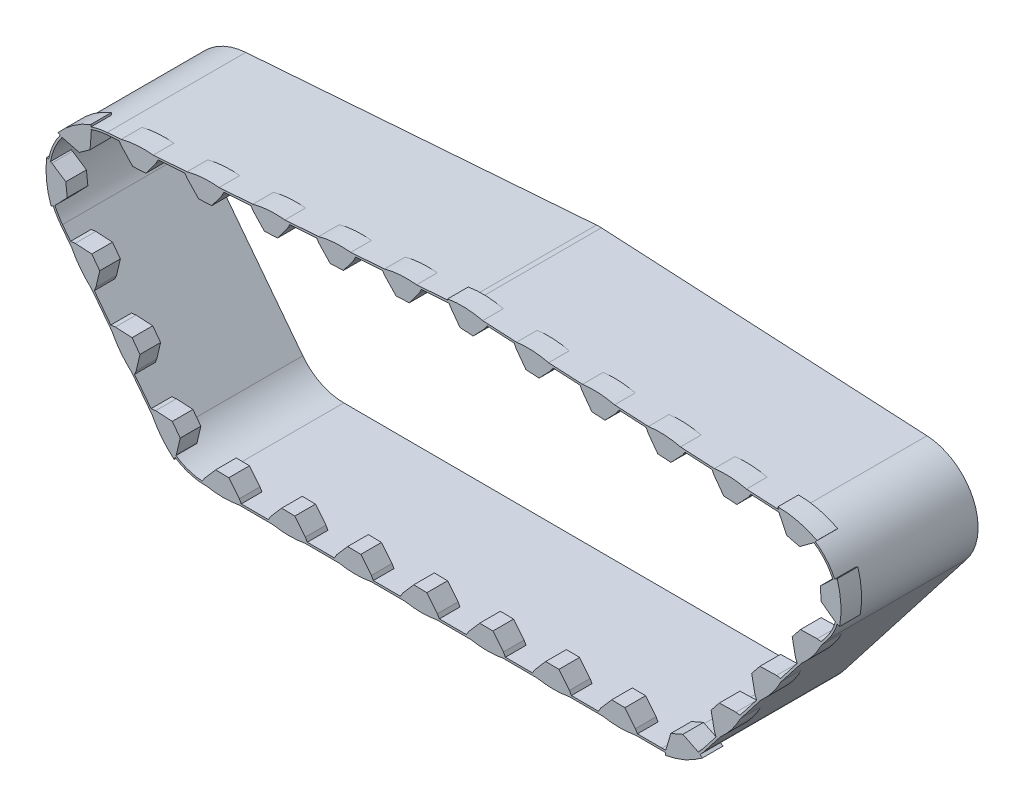
from build123d import *

# Parameters (mm, degrees)
EXTRUDE_THIN1_DEPTH = 23.5
BOSS_EXTRUDE2_DEPTH = 7
CRVPATTERN4_START   = 16.5
CRVPATTERN4_DEPTH   = 7


# Read off the part's stored shape, not the designer's step: CrvPattern4
with BuildPart() as part:
    # Sketch2 → Extrude-Thin1 (new, symmetric)
    with BuildSketch(Plane.XY):
        with BuildLine():
            Line((17.163468236, -58.085931667), (-17.281893756, -13.288195823))
            ThreePointArc((-17.281893756, -13.288195823), (-19.897637951, 8.906402414), (-1.60242719, 21.741026358))
            Line((-1.60242719, 21.741026358), (117.263507159, 30.502066523))
            ThreePointArc((117.263507159, 30.502066523), (118.105083127, 30.537349971), (118.94720479, 30.519290718))
            Line((118.94720479, 30.519290718), (229.299625502, 24.652631518))
            ThreePointArc((229.299625502, 24.652631518), (244.976573908, 13.975728829), (242.768549107, -4.862731534))
            Line((242.768549107, -4.862731534), (200.935093877, -58.602091631))
            ThreePointArc((200.935093877, -58.602091631), (194.508519277, -63.812915391), (186.443863356, -65.660852138))
            Line((186.443863356, -65.660852138), (31.619949002, -65.231091278))
            ThreePointArc((31.619949002, -65.231091278), (23.562249738, -63.336718399), (17.163468236, -58.085931667))
        make_face()
        with BuildLine():
            Line((17.71839143, -57.65924648), (-16.726970562, -12.861510636))
            ThreePointArc((-16.726970562, -12.861510636), (-19.258722971, 8.620417015), (-1.550973106, 21.042920007))
            Line((-1.550973106, 21.042920007), (117.314961243, 29.803960172))
            ThreePointArc((117.314961243, 29.803960172), (118.112243739, 29.837386596), (118.910043209, 29.820277831))
            Line((118.910043209, 29.820277831), (229.262463921, 23.95361863))
            ThreePointArc((229.262463921, 23.95361863), (244.339747634, 13.685122055), (242.216182798, -4.432741463))
            Line((242.216182798, -4.432741463), (200.382727568, -58.17210156))
            ThreePointArc((200.382727568, -58.17210156), (194.201978227, -63.183604192), (186.445806412, -64.960854834))
            Line((186.445806412, -64.960854834), (31.621892057, -64.531093975))
            ThreePointArc((31.621892057, -64.531093975), (23.872410798, -62.709183447), (17.71839143, -57.65924648))
        make_face(mode=Mode.SUBTRACT)
    extrude(amount=EXTRUDE_THIN1_DEPTH, both=True)

    # Sketch4 → Boss-Extrude2 (add)
    with BuildSketch(Plane.XY.offset(23.5)):
        with BuildLine():
            Line((-22.091749971, 4.168077882), (-20.324857335, 3.393288321))
            Line((-20.324857335, 3.393288321), (-15.620947302, 0.258821223))
            Line((-15.620947302, 0.258821223), (-15.128773127, -4.183345681))
            Line((-15.128773127, -4.183345681), (-19.032446032, -8.27149825))
            Line((-19.032446032, -8.27149825), (-20.586879792, -9.414277379))
            ThreePointArc((-20.586879792, -9.414277379), (-22.145163092, -2.71238448), (-22.091749971, 4.168077882))
        make_face()
    extrude(amount=-BOSS_EXTRUDE2_DEPTH)

    # CrvPattern4 outline → CrvPattern4 (add)
    with BuildSketch(Plane.XY.offset(CRVPATTERN4_START)):
        Polygon((-13.995992217, -16.413270275), (-5.946516809, -26.881973525), (-5.407950455, -25.625727536), (-4.116665995, -20.122615868), (-6.793577986, -16.543618186), (-12.437314215, -16.22755655), align=None)
        Polygon((1.203948182, -33.968629198), (-0.35472982, -34.154342922), (7.694745589, -44.623046172), (8.233311942, -43.366800183), (9.524596403, -37.863688516), (6.847684411, -34.284690833), align=None)
        with BuildLine():
            Line((14.84521058, -51.709701846), (13.286532578, -51.89541557))
            Line((13.286532578, -51.89541557), (17.71839143, -57.65924648))
            ThreePointArc((17.71839143, -57.65924648), (19.572941622, -59.714085103), (21.726723374, -61.452746183))
            Line((21.726723374, -61.452746183), (21.87457434, -61.107872831))
            Line((21.87457434, -61.107872831), (23.1658588, -55.604761163))
            Line((23.1658588, -55.604761163), (20.488946809, -52.025763481))
            Line((20.488946809, -52.025763481), (14.84521058, -51.709701846))
        make_face()
        with BuildLine():
            ThreePointArc((-7.01320231, 19.900376714), (-12.454147841, 17.032445554), (-16.836880551, 12.717289542))
            Line((-16.836880551, 12.717289542), (-16.512243373, 12.569705806))
            Line((-16.512243373, 12.569705806), (-11.038407177, 11.159467927))
            Line((-11.038407177, 11.159467927), (-7.40223924, 13.758191643))
            Line((-7.40223924, 13.758191643), (-6.963947723, 19.393753206))
            Line((-6.963947723, 19.393753206), (-7.01320231, 19.900376714))
        make_face()
        with BuildLine():
            Line((31.47654538, -63.181845509), (30.684865179, -64.503527555))
            ThreePointArc((30.684865179, -64.503527555), (31.153195051, -64.523550503), (31.621892057, -64.531093975))
            Line((31.621892057, -64.531093975), (43.875482358, -64.565107541))
            Line((43.875482358, -64.565107541), (43.211193095, -63.370566844))
            Line((43.211193095, -63.370566844), (39.647884743, -58.98257332))
            Line((39.647884743, -58.98257332), (35.179113421, -58.910704738))
            Line((35.179113421, -58.910704738), (31.47654538, -63.181845509))
        make_face()
        Polygon((15.637424805, 22.309794703), (2.46755138, 21.339106249), (3.221017708, 20.198713249), (7.108634912, 16.095289549), (11.569869984, 16.364480656), (14.935875815, 20.905588267), align=None)
        Polygon((37.956108944, 23.954798289), (24.786235519, 22.984109835), (25.539701847, 21.843716834), (29.427319051, 17.740293135), (33.888554123, 18.009484242), (37.254559954, 22.550591853), align=None)
        Polygon((53.855683871, -63.243965614), (53.049074347, -64.590571636), (66.254620849, -64.627227646), (65.590331586, -63.432686949), (62.027023233, -59.044693425), (57.558251911, -58.972824843), align=None)
        Polygon((60.274793082, 25.599801874), (47.104919658, 24.62911342), (47.858385986, 23.48872042), (51.74600319, 19.38529672), (56.207238262, 19.654487827), (59.573244092, 24.195595438), align=None)
        Polygon((76.234822361, -63.306085719), (75.428212837, -64.65269174), (88.633759339, -64.689347751), (87.969470076, -63.494807053), (84.406161724, -59.10681353), (79.937390402, -59.034944948), align=None)
        Polygon((82.593477221, 27.244805459), (69.423603797, 26.274117005), (70.177070125, 25.133724005), (74.064687329, 21.030300305), (78.525922401, 21.299491412), (81.891928231, 25.840599023), align=None)
        Polygon((98.613960852, -63.368205824), (97.807351328, -64.714811845), (111.01289783, -64.751467856), (110.348608567, -63.556927158), (106.785300214, -59.168933634), (102.316528892, -59.097065053), align=None)
        Polygon((104.91216136, 28.889809044), (91.742287936, 27.91912059), (92.495754264, 26.77872759), (96.383371468, 22.675303891), (100.84460654, 22.944494998), (104.21061237, 27.485602608), align=None)
        Polygon((120.993099342, -63.430325929), (120.186489818, -64.77693195), (133.39203632, -64.813587961), (132.727747057, -63.619047263), (129.164438705, -59.231053739), (124.695667383, -59.159185158), align=None)
        with BuildLine():
            Line((117.314961243, 29.803960172), (114.302019504, 29.58189063))
            Line((114.302019504, 29.58189063), (114.661190298, 28.851782918))
            Line((114.661190298, 28.851782918), (117.999199405, 24.290056404))
            Line((117.999199405, 24.290056404), (122.458694241, 23.993428653))
            Line((122.458694241, 23.993428653), (126.371478681, 28.072861397))
            Line((126.371478681, 28.072861397), (127.244822194, 29.377176469))
            Line((127.244822194, 29.377176469), (118.910043209, 29.820277831))
            ThreePointArc((118.910043209, 29.820277831), (118.112243739, 29.837386596), (117.314961243, 29.803960172))
        make_face()
        Polygon((143.372237833, -63.492446034), (142.565628309, -64.839052055), (155.771174811, -64.875708065), (155.106885548, -63.681167368), (151.543577195, -59.293173844), (147.074805873, -59.221305263), align=None)
        Polygon((165.751376323, -63.554566139), (164.944766799, -64.90117216), (178.150313301, -64.93782817), (177.486024038, -63.743287473), (173.922715686, -59.355293949), (169.453944364, -59.283425368), align=None)
        Polygon((149.592488599, 28.189108805), (136.405513236, 28.890167195), (137.008856702, 27.663715253), (140.346865809, 23.10198874), (144.806360645, 22.805360989), (148.719145085, 26.884793733), align=None)
        with BuildLine():
            Line((187.869484076, -64.586368055), (187.833615081, -64.90991692))
            ThreePointArc((187.833615081, -64.90991692), (193.730921212, -63.404504817), (198.76283621, -59.980425866))
            Line((198.76283621, -59.980425866), (198.617994631, -59.873927753))
            Line((198.617994631, -59.873927753), (193.551672853, -57.36712955))
            Line((193.551672853, -57.36712955), (189.458440838, -59.16171415))
            Line((189.458440838, -59.16171415), (187.869484076, -64.586368055))
        make_face()
        Polygon((171.940155003, 27.001041141), (158.75317964, 27.702099531), (159.356523106, 26.475647589), (162.694532213, 21.913921075), (167.154027049, 21.617293325), (171.066811489, 25.696726069), align=None)
        Polygon((194.287821407, 25.812973477), (181.100846044, 26.514031866), (181.70418951, 25.287579925), (185.042198617, 20.725853411), (189.501693454, 20.429225661), (193.414477893, 24.508658405), align=None)
        Polygon((204.236877518, -51.025214548), (204.808060631, -52.487307757), (212.919883132, -42.066840502), (211.568646823, -41.861005275), (205.917610186, -41.993060232), (203.125536559, -45.482960959), align=None)
        Polygon((216.635487811, 24.624905812), (203.448512448, 25.325964202), (204.051855915, 24.099512261), (207.389865021, 19.537785747), (211.849359858, 19.241157997), (215.762144297, 23.32059074), align=None)
        Polygon((217.98379811, -33.365886342), (218.554981224, -34.827979551), (226.666803724, -24.407512296), (225.315567415, -24.201677069), (219.664530778, -24.333732025), (216.872457151, -27.823632752), align=None)
        with BuildLine():
            Line((229.262463921, 23.95361863), (226.180679677, 24.117455343))
            Line((226.180679677, 24.117455343), (226.307088862, 23.683522876))
            Line((226.307088862, 23.683522876), (228.806400546, 18.613503676))
            Line((228.806400546, 18.613503676), (233.147508098, 17.550551445))
            Line((233.147508098, 17.550551445), (237.706501394, 20.892292563))
            Line((237.706501394, 20.892292563), (237.931645613, 21.127410691))
            ThreePointArc((237.931645613, 21.127410691), (233.783258382, 23.111680338), (229.262463921, 23.95361863))
        make_face()
        Polygon((231.730718702, -15.706558135), (232.301901816, -17.168651344), (240.413724316, -6.748184089), (239.062488007, -6.542348862), (233.411451371, -6.674403818), (230.619377743, -10.164304545), align=None)
        with BuildLine():
            ThreePointArc((245.252765769, 1.549750593), (245.885449328, 7.603195622), (244.418435091, 13.510170688))
            Line((244.418435091, 13.510170688), (244.268323741, 13.411238824))
            Line((244.268323741, 13.411238824), (240.160431112, 9.528344062))
            Line((240.160431112, 9.528344062), (240.424490607, 5.06680231))
            Line((240.424490607, 5.06680231), (244.961723542, 1.6955754))
            Line((244.961723542, 1.6955754), (245.252765769, 1.549750593))
        make_face()
        with BuildLine():
            Line((-6.946166616, -26.730271835), (-13.590426056, -18.089114882))
            ThreePointArc((-13.590426056, -18.089114882), (-10.675136676, -22.722516373), (-6.946166616, -26.730271835))
        make_face()
        with BuildLine():
            Line((6.695095781, -44.471344482), (0.050836341, -35.830187529))
            ThreePointArc((0.050836341, -35.830187529), (2.966125722, -40.46358902), (6.695095781, -44.471344482))
        make_face()
        with BuildLine():
            Line((-18.268572187, 13.368152766), (-17.489366985, 13.013917261))
            ThreePointArc((-17.489366985, 13.013917261), (-12.860866915, 17.602218672), (-7.082901217, 20.617286687))
            Line((-7.082901217, 20.617286687), (-7.150636779, 21.314002056))
            ThreePointArc((-7.150636779, 21.314002056), (-13.181035859, 18.000710309), (-18.268572187, 13.368152766))
        make_face()
        with BuildLine():
            Line((17.163468236, -58.085931667), (13.692098739, -53.571260177))
            ThreePointArc((13.692098739, -53.571260177), (16.923624315, -58.608548326), (21.114375882, -62.881092151))
            Line((21.114375882, -62.881092151), (21.445762422, -62.108108454))
            ThreePointArc((21.445762422, -62.108108454), (19.142152133, -60.269989882), (17.163468236, -58.085931667))
        make_face()
        with BuildLine():
            ThreePointArc((14.014498968, 22.892075379), (8.541386825, 23.0032735), (3.143721509, 22.090842305))
            Line((3.143721509, 22.090842305), (14.014498968, 22.892075379))
        make_face()
        with BuildLine():
            ThreePointArc((36.333183107, 24.537078964), (30.860070964, 24.648277085), (25.462405648, 23.73584589))
            Line((25.462405648, 23.73584589), (36.333183107, 24.537078964))
        make_face()
        with BuildLine():
            Line((43.143944183, -65.263079631), (32.24372118, -65.232822747))
            ThreePointArc((32.24372118, -65.232822747), (37.692408136, -65.761152194), (43.143944183, -65.263079631))
        make_face()
        with BuildLine():
            ThreePointArc((58.651867245, 26.182082549), (53.178755103, 26.293280671), (47.781089787, 25.380849476))
            Line((47.781089787, 25.380849476), (58.651867245, 26.182082549))
        make_face()
        with BuildLine():
            Line((65.523082674, -65.325199736), (54.622859671, -65.294942852))
            ThreePointArc((54.622859671, -65.294942852), (60.071546627, -65.823272298), (65.523082674, -65.325199736))
        make_face()
        with BuildLine():
            ThreePointArc((80.970551384, 27.827086135), (75.497439242, 27.938284256), (70.099773926, 27.025853061))
            Line((70.099773926, 27.025853061), (80.970551384, 27.827086135))
        make_face()
        with BuildLine():
            Line((87.902221164, -65.387319841), (77.001998161, -65.357062957))
            ThreePointArc((77.001998161, -65.357062957), (82.450685117, -65.885392403), (87.902221164, -65.387319841))
        make_face()
        with BuildLine():
            ThreePointArc((103.289235523, 29.47208972), (97.816123381, 29.583287841), (92.418458065, 28.670856646))
            Line((92.418458065, 28.670856646), (103.289235523, 29.47208972))
        make_face()
        with BuildLine():
            Line((110.281359655, -65.449439946), (99.381136652, -65.419183062))
            ThreePointArc((99.381136652, -65.419183062), (104.829823608, -65.947512508), (110.281359655, -65.449439946))
        make_face()
        with BuildLine():
            Line((113.809557497, 30.582947272), (113.968807701, 30.259229966))
            Line((113.968807701, 30.259229966), (117.263507159, 30.502066523))
            ThreePointArc((117.263507159, 30.502066523), (118.105083127, 30.537349971), (118.94720479, 30.519290718))
            Line((118.94720479, 30.519290718), (125.708471364, 30.159841904))
            ThreePointArc((125.708471364, 30.159841904), (119.780811476, 30.984388866), (113.809557497, 30.582947272))
        make_face()
        with BuildLine():
            Line((132.660498145, -65.511560051), (121.760275142, -65.481303167))
            ThreePointArc((121.760275142, -65.481303167), (127.208962098, -66.009632613), (132.660498145, -65.511560051))
        make_face()
        with BuildLine():
            Line((155.039636636, -65.573680156), (144.139413633, -65.543423272))
            ThreePointArc((144.139413633, -65.543423272), (149.588100589, -66.071752718), (155.039636636, -65.573680156))
        make_face()
        with BuildLine():
            ThreePointArc((148.056137768, 28.97177424), (142.640935738, 29.773590006), (137.171243897, 29.550447207))
            Line((137.171243897, 29.550447207), (148.056137768, 28.97177424))
        make_face()
        with BuildLine():
            Line((177.418775126, -65.63580026), (166.518552123, -65.605543376))
            ThreePointArc((166.518552123, -65.605543376), (171.967239079, -66.133872823), (177.418775126, -65.63580026))
        make_face()
        with BuildLine():
            ThreePointArc((170.403804172, 27.783706576), (164.988602142, 28.585522342), (159.518910301, 28.362379543))
            Line((159.518910301, 28.362379543), (170.403804172, 27.783706576))
        make_face()
        with BuildLine():
            ThreePointArc((192.751470576, 26.595638911), (187.336268546, 27.397454678), (181.866576705, 27.174311879))
            Line((181.866576705, 27.174311879), (192.751470576, 26.595638911))
        make_face()
        with BuildLine():
            ThreePointArc((199.334305909, -60.400612151), (194.011808044, -64.045720838), (187.755176224, -65.61745845))
            Line((187.755176224, -65.61745845), (187.65690175, -66.503923062))
            ThreePointArc((187.65690175, -66.503923062), (194.24018174, -64.502913355), (200.172354817, -61.016806951))
            Line((200.172354817, -61.016806951), (199.334305909, -60.400612151))
        make_face()
        with BuildLine():
            ThreePointArc((215.09913698, 25.407571247), (209.68393495, 26.209387014), (204.214243109, 25.986244215))
            Line((204.214243109, 25.986244215), (215.09913698, 25.407571247))
        make_face()
        with BuildLine():
            Line((213.024078204, -43.072552453), (206.328355751, -51.673894083))
            ThreePointArc((206.328355751, -51.673894083), (210.081182744, -47.688469248), (213.024078204, -43.072552453))
        make_face()
        with BuildLine():
            Line((225.767491778, 25.535830475), (225.973261937, 24.829470787))
            Line((225.973261937, 24.829470787), (229.299625502, 24.652631518))
            ThreePointArc((229.299625502, 24.652631518), (234.062956059, 23.756630834), (238.423994378, 21.641570551))
            Line((238.423994378, 21.641570551), (239.040848288, 22.285751145))
            ThreePointArc((239.040848288, 22.285751145), (232.596998932, 24.698305963), (225.767491778, 25.535830475))
        make_face()
        with BuildLine():
            Line((226.770998796, -25.413224246), (220.075276343, -34.014565876))
            ThreePointArc((220.075276343, -34.014565876), (223.828103336, -30.029141041), (226.770998796, -25.413224246))
        make_face()
        with BuildLine():
            Line((245.879236217, 14.47292119), (245.010696574, 13.900504478))
            ThreePointArc((245.010696574, 13.900504478), (246.584278947, 7.644336372), (245.889221296, 1.23085871))
            Line((245.889221296, 1.23085871), (246.686623679, 0.831325456))
            ThreePointArc((246.686623679, 0.831325456), (247.092292927, 7.700026042), (245.879236217, 14.47292119))
        make_face()
        with BuildLine():
            Line((240.517919388, -7.753896039), (233.822196936, -16.355237669))
            ThreePointArc((233.822196936, -16.355237669), (237.575023928, -12.369812834), (240.517919388, -7.753896039))
        make_face()
    extrude(amount=CRVPATTERN4_DEPTH)


solid = part.part
